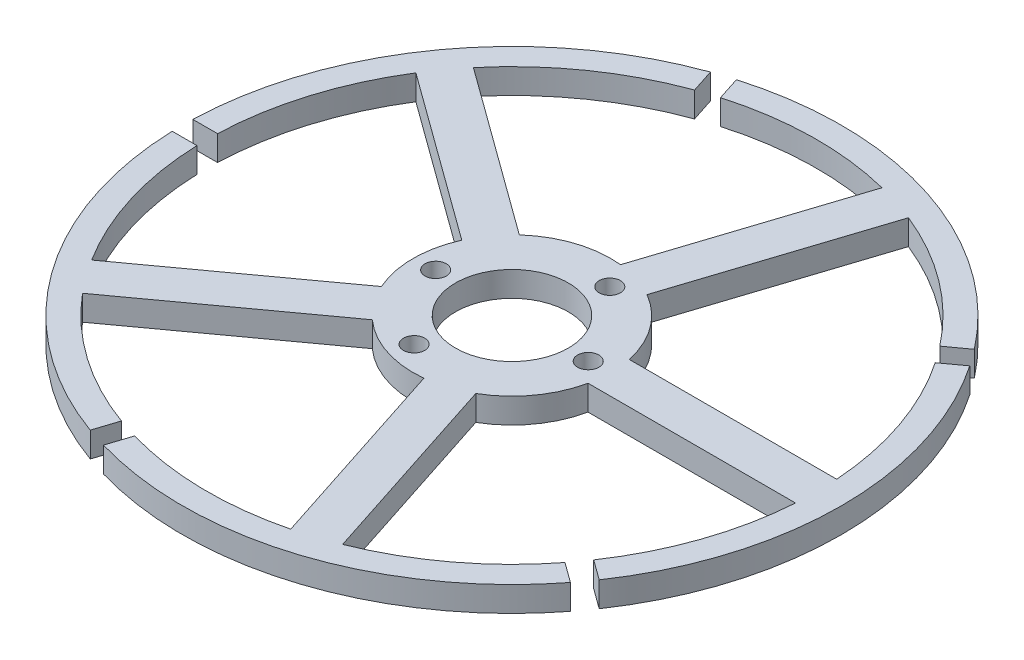
from build123d import *

# Parameters (mm, degrees)
SKETCH1_R                = 20
BOSS_EXTRUDE1_DEPTH      = 1.52
SKETCH2_R                = 18.5
SKETCH2_R_2              = 6
CUT_EXTRUDE1_DEPTH       = 29.325084289
BOSS_EXTRUDE3_REACH      = 30.325
BOSS_EXTRUDE3_END_RADIUS = 18.5
SKETCH10_W               = 2.5
SKETCH10_H               = 1.52
CIRPATTERN1_COUNT        = 5
SKETCH3_R                = 3.425
CUT_EXTRUDE3_DEPTH       = 29.325084289
CUT_EXTRUDE8_DEPTH       = 29.325084289
SKETCH15_R               = 0.646183222
CUT_EXTRUDE10_DEPTH      = 29.325084289


with BuildPart() as part:
    # Sketch1 → Boss-Extrude1 (new body)
    with BuildSketch(Plane(origin=(0, 0, 0), x_dir=(1, 0, 0), z_dir=(0, 1, 0))):
        Circle(SKETCH1_R)
    extrude(amount=BOSS_EXTRUDE1_DEPTH)

    # Sketch2 → Cut-Extrude1 (cut, through all)
    with BuildSketch(Plane(origin=(0, 1.52, 0), x_dir=(1, 0, 0), z_dir=(0, 1, 0))):
        Circle(SKETCH2_R)
        Circle(SKETCH2_R_2, mode=Mode.SUBTRACT)
    extrude(amount=-CUT_EXTRUDE1_DEPTH, mode=Mode.SUBTRACT)


with BuildPart() as cut_extrude1_piece_1:
    # of the separate pieces the step leaves, piece 1, a body of its own (cut_extrude1_pieces)
    add(part.part.solids().sort_by_distance((20, 0, 0))[0])



with BuildPart() as cut_extrude1_piece_2:
    # of the separate pieces the step leaves, piece 2, a body of its own (cut_extrude1_pieces)
    add(part.part.solids().sort_by_distance((6, 0, 0))[0])


with BuildPart() as cut_extrude1_piece_1_1:
    add(cut_extrude1_piece_1.part)

    add(cut_extrude1_piece_2.part)  # Boss-Extrude3 merges Cut-Extrude1 piece 2
    # Boss-Extrude3: up to this cylinder (the profile starts inside it)
    boss_extrude3_end = Plane(origin=(0, 0.76, 0), z_dir=(0, 1, 0)) * Cylinder(BOSS_EXTRUDE3_END_RADIUS, 98.65, mode=Mode.PRIVATE)
    # Sketch10 → Boss-Extrude3 (add, up to the surface)
    with BuildSketch(Plane(origin=(0, 0, 0), x_dir=(0, 0, -1), z_dir=(1, 0, 0)), mode=Mode.PRIVATE) as boss_extrude3_sk1:
        with Locations((0, 0.76)):
            Rectangle(SKETCH10_W, SKETCH10_H)
    boss_extrude3_tool1 = extrude(boss_extrude3_sk1.sketch, amount=BOSS_EXTRUDE3_REACH, mode=Mode.PRIVATE) & boss_extrude3_end
    boss_extrude3 = boss_extrude3_tool1.solids().sort_by_distance((0, 0.76, 0))[0]
    add(boss_extrude3)

    # CirPattern1: Boss-Extrude3 ×5 about axis
    cirpattern1_axis = Axis((0, 1.52, 0), (0, -1, 0))
    for i in range(1, CIRPATTERN1_COUNT):
        add(boss_extrude3.rotate(cirpattern1_axis, i * 360 / CIRPATTERN1_COUNT))

    # Sketch3 → Cut-Extrude3 (cut, through all)
    with BuildSketch(Plane(origin=(0, 1.52, 0), x_dir=(1, 0, 0), z_dir=(0, 1, 0))):
        Circle(SKETCH3_R)
    extrude(amount=-CUT_EXTRUDE3_DEPTH, mode=Mode.SUBTRACT)

    # Sketch12 → Cut-Extrude8 (cut, through all)
    with BuildSketch(Plane(origin=(0, 1.52, 0), x_dir=(1, 0, 0), z_dir=(0, 1, 0))):
        with BuildLine():
            Line((16.539803184, 11.244327932), (15.325636598, 10.362184271))
            Line((15.325636598, 10.362184271), (14.590905033, 11.373455514))
            Line((14.590905033, 11.373455514), (15.805071618, 12.255599175))
            ThreePointArc((15.805071618, 12.255599175), (16.180339887, 11.755705046), (16.539803184, 11.244327932))
        make_face()
        with BuildLine():
            Line((-6.771731729, 18.818704775), (-6.307961361, 17.391366348))
            Line((-6.307961361, 17.391366348), (-5.119140716, 17.777637591))
            Line((-5.119140716, 17.777637591), (-5.582911084, 19.204976017))
            ThreePointArc((-5.582911084, 19.204976017), (-6.180339887, 19.021130326), (-6.771731729, 18.818704775))
        make_face()
        with BuildLine():
            Line((15.805071618, -12.255599175), (14.590905033, -11.373455514))
            Line((14.590905033, -11.373455514), (15.325636598, -10.362184271))
            Line((15.325636598, -10.362184271), (16.539803184, -11.244327932))
            ThreePointArc((16.539803184, -11.244327932), (16.180339887, -11.755705046), (15.805071618, -12.255599175))
        make_face()
        with BuildLine():
            Line((-6.771731729, -18.818704775), (-6.307961361, -17.391366348))
            Line((-6.307961361, -17.391366348), (-5.119140716, -17.777637591))
            Line((-5.119140716, -17.777637591), (-5.582911084, -19.204976017))
            ThreePointArc((-5.582911084, -19.204976017), (-6.180339887, -19.021130326), (-6.771731729, -18.818704775))
        make_face()
        with BuildLine():
            Line((-19.99023199, 0.625), (-18.489439553, 0.625))
            Line((-18.489439553, 0.625), (-18.489439553, -0.625))
            Line((-18.489439553, -0.625), (-19.99023199, -0.625))
            ThreePointArc((-19.99023199, -0.625), (-20, 0), (-19.99023199, 0.625))
        make_face()
    extrude(amount=-CUT_EXTRUDE8_DEPTH, mode=Mode.SUBTRACT)

    # Sketch15 → Cut-Extrude10 (cut, through all)
    with BuildSketch(Plane(origin=(0, 1.52, 0), x_dir=(1, 0, 0), z_dir=(0, 1, 0))):
        with Locations((1.456242586, 4.481853833)):
            Circle(SKETCH15_R)
        with Locations((-1.456242586, -4.481853833)):
            Circle(SKETCH15_R)
        with Locations((4.711782263, -0.082244465)):
            Circle(SKETCH15_R)
        with Locations((-4.711782263, 0.082244465)):
            Circle(SKETCH15_R)
    extrude(amount=-CUT_EXTRUDE10_DEPTH, mode=Mode.SUBTRACT)


solid = cut_extrude1_piece_1_1.part
